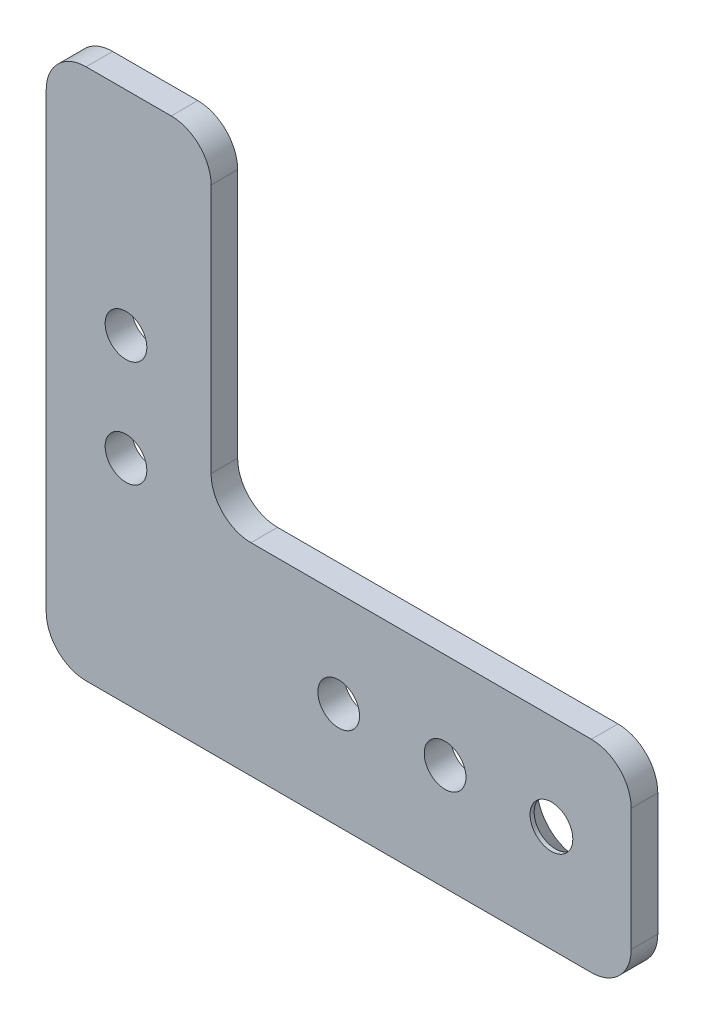
from build123d import *

# Parameters (mm, degrees)
SKETCH1_R                                       = 2.4892
BASE_FLANGE1_DEPTH                              = 3.175
FILLET2_R                                       = 4.7625
CSK_FOR_10_FLAT_HEAD_MACHINE_SCREW1_D           = 5.1054
CSK_FOR_10_FLAT_HEAD_MACHINE_SCREW1_DEPTH       = 19.05
CSK_FOR_10_FLAT_HEAD_MACHINE_SCREW1_CSINK_D     = 9.779
CSK_FOR_10_FLAT_HEAD_MACHINE_SCREW1_CSINK_ANGLE = 82
CSK_FOR_10_FLAT_HEAD_MACHINE_SCREW1_TIP         = 1.533816902


# Sheet-metal steps are written as plain solids
with BuildPart() as part:
    # Sketch1 → Base-Flange1 (new body)
    with BuildSketch(Plane.XY):
        Polygon((-15.24, 31.75), (-34.925, 31.75), (-34.925, -31.75), (34.925, -31.75), (34.925, -7.62), (-15.24, -7.62), align=None)
        with Locations((-25.4, -6.35)):
            Circle(SKETCH1_R, mode=Mode.SUBTRACT)
        with Locations((-25.4, 6.35)):
            Circle(SKETCH1_R, mode=Mode.SUBTRACT)
        with Locations((0, -19.05)):
            Circle(SKETCH1_R, mode=Mode.SUBTRACT)
        with Locations((12.7, -19.05)):
            Circle(SKETCH1_R, mode=Mode.SUBTRACT)
        with Locations((25.4, -19.05)):
            Circle(SKETCH1_R, mode=Mode.SUBTRACT)
    extrude(amount=-BASE_FLANGE1_DEPTH)

    # Fillet2
    fillet2_edges = [part.edges().sort_by_distance(p)[0] for p in [
        (-34.925, -31.75, -1.5875),
        (34.925, -31.75, -1.5875),
        (34.925, -7.62, -1.5875),
        (-15.24, -7.62, -1.5875),
        (-15.24, 31.75, -1.5875),
        (-34.925, 31.75, -1.5875),
    ]]
    fillet(fillet2_edges, radius=FILLET2_R)

    # CSK for #10 Flat Head Machine Screw1
    with Locations(Plane(origin=(0, 0, -3.175), x_dir=(-1, 0, 0), z_dir=(0, 0, -1))):
        with Locations((-25.4, -19.05)):
            CounterSinkHole(CSK_FOR_10_FLAT_HEAD_MACHINE_SCREW1_D / 2, CSK_FOR_10_FLAT_HEAD_MACHINE_SCREW1_CSINK_D / 2, depth=CSK_FOR_10_FLAT_HEAD_MACHINE_SCREW1_DEPTH, counter_sink_angle=CSK_FOR_10_FLAT_HEAD_MACHINE_SCREW1_CSINK_ANGLE)
            with Locations((0, 0, -(CSK_FOR_10_FLAT_HEAD_MACHINE_SCREW1_DEPTH + CSK_FOR_10_FLAT_HEAD_MACHINE_SCREW1_TIP / 2))):  # 118° drill point
                Cone(0, CSK_FOR_10_FLAT_HEAD_MACHINE_SCREW1_D / 2, CSK_FOR_10_FLAT_HEAD_MACHINE_SCREW1_TIP, mode=Mode.SUBTRACT)


solid = part.part
